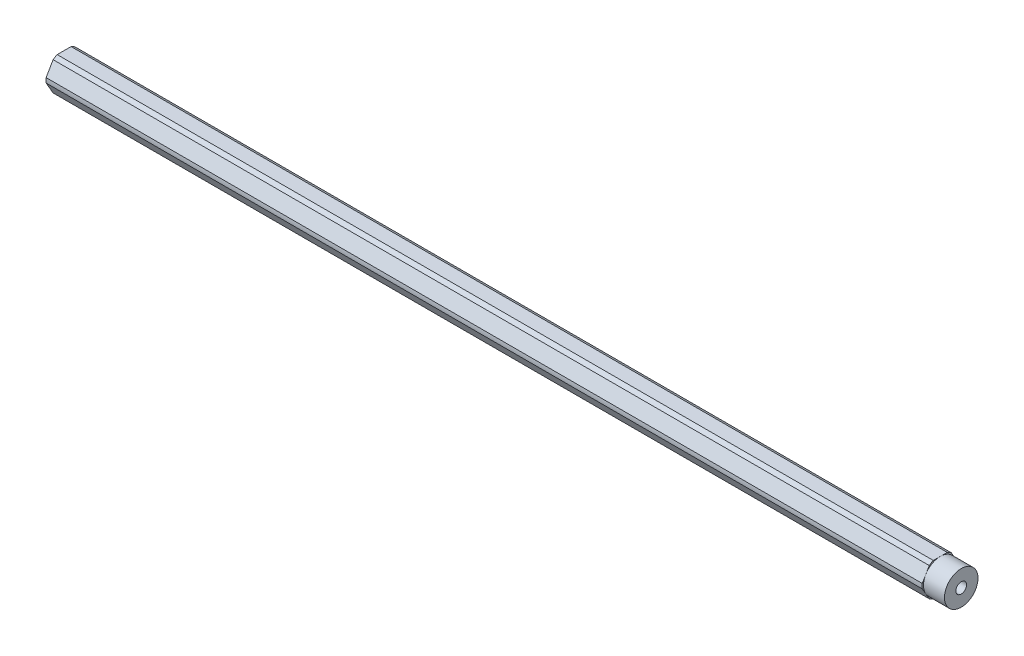
from build123d import *

# Parameters (mm, degrees)
SKETCH1_R                            = 2.0193
BOSS_EXTRUDE1_DEPTH                  = 169.8625
F_10_32_TAPPED_HOLE1_D               = 4.0386
F_10_32_TAPPED_HOLE1_DEPTH           = 16.34744
F_10_32_TAPPED_HOLE1_TIP             = 1.213317848
F_10_32_TAPPED_HOLE1_ON_FACE_2_D     = 4.0386
F_10_32_TAPPED_HOLE1_ON_FACE_2_DEPTH = 16.34744
F_10_32_TAPPED_HOLE1_ON_FACE_2_TIP   = 1.213317848
SKETCH3_R                            = 8.89
SKETCH3_R_2                          = 6.35
CUT_EXTRUDE_THIN1_DEPTH              = 7.9375


with BuildPart() as part:
    # Sketch1 → Boss-Extrude1 (new, symmetric)
    with BuildSketch(Plane(origin=(0, 0, 0), x_dir=(0, 0, -1), z_dir=(1, 0, 0))):
        with BuildLine():
            ThreePointArc((4.181770846, 5.456960429), (3.437499983, 5.953924622), (2.634980936, 6.35))
            Line((2.634980936, 6.35), (-2.634980936, 6.35))
            ThreePointArc((-2.634980936, 6.35), (-3.437499983, 5.953924622), (-4.181770846, 5.456960429))
            Line((-4.181770846, 5.456960429), (-6.816751782, 0.893039571))
            ThreePointArc((-6.816751782, 0.893039571), (-6.874999966, 0), (-6.816751782, -0.893039571))
            Line((-6.816751782, -0.893039571), (-4.181770846, -5.456960429))
            ThreePointArc((-4.181770846, -5.456960429), (-3.437499983, -5.953924622), (-2.634980936, -6.35))
            Line((-2.634980936, -6.35), (2.634980936, -6.35))
            ThreePointArc((2.634980936, -6.35), (3.437499983, -5.953924622), (4.181770846, -5.456960429))
            Line((4.181770846, -5.456960429), (6.816751782, -0.893039571))
            ThreePointArc((6.816751782, -0.893039571), (6.860422465, -0.447468582), (6.874999966, 0))
            ThreePointArc((6.874999966, 0), (6.860422465, 0.447468582), (6.816751782, 0.893039571))
            Line((6.816751782, 0.893039571), (4.181770846, 5.456960429))
        make_face()
        Circle(SKETCH1_R, mode=Mode.SUBTRACT)
    extrude(amount=BOSS_EXTRUDE1_DEPTH, both=True)

    # #10-32 Tapped Hole1
    with Locations(Plane(origin=(169.8625, 0, 0), x_dir=(0, 0, 1), z_dir=(1, 0, 0))):
        with Locations((0, 0)):
            Hole(F_10_32_TAPPED_HOLE1_D / 2, depth=F_10_32_TAPPED_HOLE1_DEPTH)
            with Locations((0, 0, -(F_10_32_TAPPED_HOLE1_DEPTH + F_10_32_TAPPED_HOLE1_TIP / 2))):  # 118° drill point
                Cone(0, F_10_32_TAPPED_HOLE1_D / 2, F_10_32_TAPPED_HOLE1_TIP, mode=Mode.SUBTRACT)

    # #10-32 Tapped Hole1 on face 2
    with Locations(Plane(origin=(-169.8625, 0, 0), x_dir=(0, 0, 1), z_dir=(1, 0, 0))):
        with Locations((0, 0)):
            Hole(F_10_32_TAPPED_HOLE1_ON_FACE_2_D / 2, depth=F_10_32_TAPPED_HOLE1_ON_FACE_2_DEPTH)
            with Locations((0, 0, -(F_10_32_TAPPED_HOLE1_ON_FACE_2_DEPTH + F_10_32_TAPPED_HOLE1_ON_FACE_2_TIP / 2))):  # 118° drill point
                Cone(0, F_10_32_TAPPED_HOLE1_ON_FACE_2_D / 2, F_10_32_TAPPED_HOLE1_ON_FACE_2_TIP, mode=Mode.SUBTRACT)

    # Sketch3 → Cut-Extrude-Thin1 (cut)
    with BuildSketch(Plane(origin=(169.8625, 0, 0), x_dir=(0, 0, -1), z_dir=(1, 0, 0))):
        Circle(SKETCH3_R)
        Circle(SKETCH3_R_2, mode=Mode.SUBTRACT)
    extrude(amount=-CUT_EXTRUDE_THIN1_DEPTH, mode=Mode.SUBTRACT)


solid = part.part
